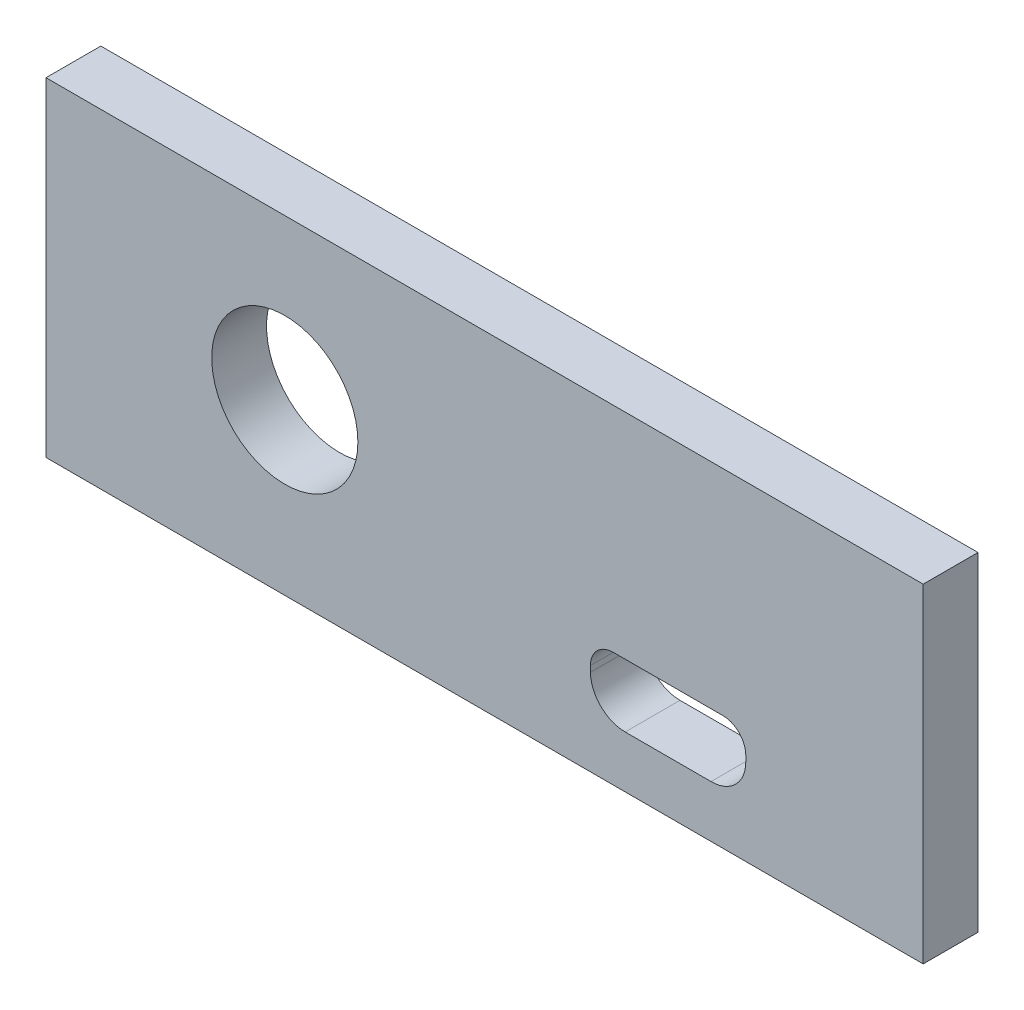
from build123d import *

# Parameters (mm, degrees)
BOSS_EXTRUDE1_START = 0.25
SKETCH1_W           = 48
SKETCH1_H           = 18
SKETCH1_R           = 4
BOSS_EXTRUDE1_DEPTH = 3


with BuildPart() as part:
    # Sketch1 → Boss-Extrude1 (new body)
    with BuildSketch(Plane.XY.offset(74.280531955).offset(BOSS_EXTRUDE1_START)):
        with Locations((32.921525611, 38.171825564)):
            Rectangle(SKETCH1_W, SKETCH1_H)
        with Locations((21.98842216, 38.436825564)):
            Circle(SKETCH1_R, mode=Mode.SUBTRACT)
        with BuildLine():
            Line((39.964312099, 35.461638729), (45.964312099, 35.461638729))
            ThreePointArc((45.964312099, 35.461638729), (46.848195575, 35.095522205), (47.214312099, 34.211638729))
            Line((47.214312099, 34.211638729), (47.214312099, 33.891638729))
            ThreePointArc((47.214312099, 33.891638729), (46.656067847, 32.554665627), (45.312842063, 32.011638729))
            Line((45.312842063, 32.011638729), (40.614312099, 32.011638729))
            ThreePointArc((40.614312099, 32.011638729), (39.278378668, 32.560558948), (38.714312099, 33.890168079))
            Line((38.714312099, 33.890168079), (38.714312099, 34.211638729))
            ThreePointArc((38.714312099, 34.211638729), (39.080428622, 35.095522205), (39.964312099, 35.461638729))
        make_face(mode=Mode.SUBTRACT)
    extrude(amount=BOSS_EXTRUDE1_DEPTH)


solid = part.part
